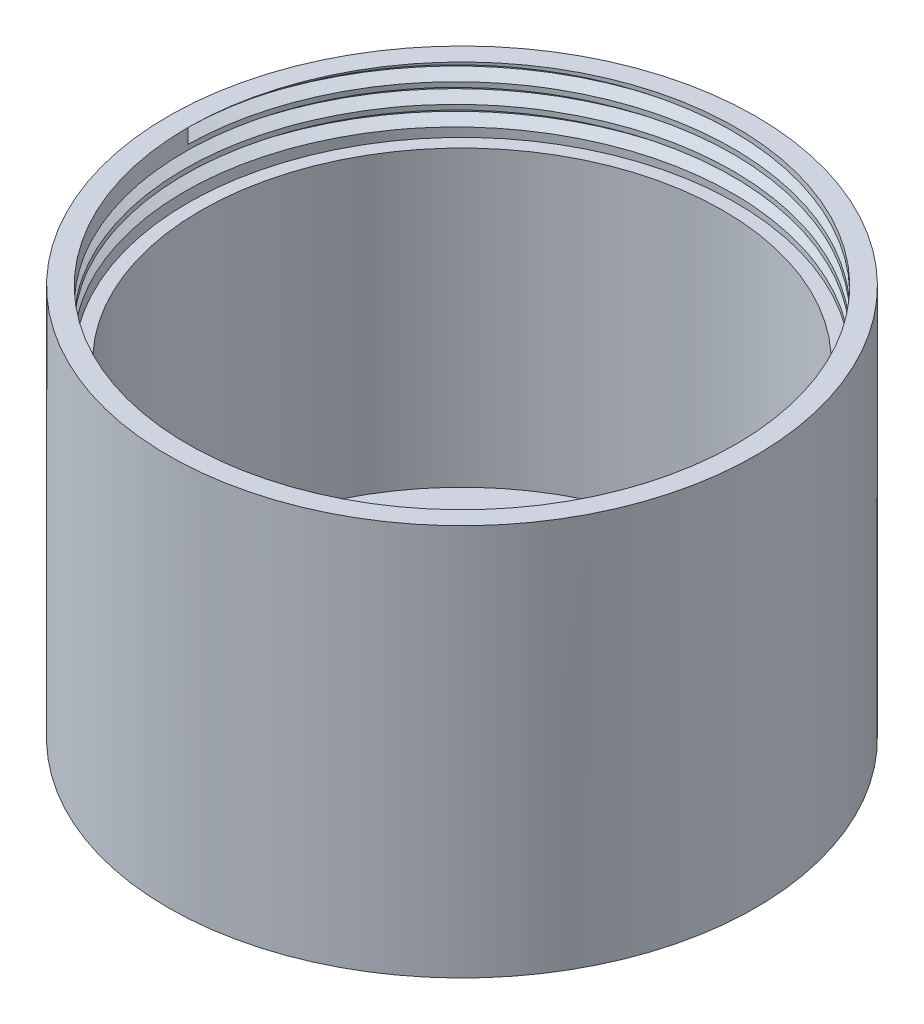
from build123d import *
from build123d.topology import SkipClean

# Parameters (mm, degrees)
SKETCH1_R           = 45
BOSS_EXTRUDE1_DEPTH = 50
SHELL1_T            = -5
SKETCH7_W           = 3
SKETCH7_H           = 10
THREAD2_PITCH       = 3


with BuildPart() as part:
    # Sketch1 → Boss-Extrude1 (new body)
    with BuildSketch(Plane(origin=(0, 0, 0), x_dir=(1, 0, 0), z_dir=(0, 1, 0))):
        with Locations(Location((0, 0, 0), (0, 0, 270))):
            Circle(SKETCH1_R)
    extrude(amount=BOSS_EXTRUDE1_DEPTH)

    # Shell1
    shell1_openings = [part.faces().sort_by_distance(p)[0] for p in [
        (0, 50, 0),
    ]]
    offset(amount=SHELL1_T, openings=shell1_openings, kind=Kind.INTERSECTION)

    # Sketch7 → Revolve2 (revolve)
    with SkipClean():  # the faces are left unmerged after this step: merging them gives an invalid solid
        with BuildSketch(Plane(origin=(0, 0, 0), x_dir=(0, 0, -1), z_dir=(1, 0, 0)), mode=Mode.PRIVATE) as revolve2_sk:
            with Locations((-43.5, 55)):
                Rectangle(SKETCH7_W, SKETCH7_H)
        revolve(revolve2_sk.sketch.rotate(Axis((0, 0, 0), (0, 1, 0)), 180), axis=Axis((0, 0, 0), (0, 1, 0)))

    # Thread2: the profile of Thread Profile2 profile screwed along a right-hand helix of 2.666667 turns, 10 arcs to a turn; built about Z, then put on its axis
    with SkipClean():  # the faces are left unmerged after this step: merging them gives an invalid solid
        thread2_z = Axis((0, 0, 0), (0, 0, 1))
        thread2_corners = [(41.9997, 0, -0.000173205), (43.623797625, 0, 0.937499996), (43.623797625, 0, 1.312499996), (41.9997, 0, 2.250173197)]
        with BuildLine(mode=Mode.PRIVATE) as thread2_profile:
            Line(thread2_corners[0], thread2_corners[1])
            Line(thread2_corners[1], thread2_corners[2])
            Line(thread2_corners[2], thread2_corners[3])
            Line(thread2_corners[3], thread2_corners[0])
        thread2_cap = Face(thread2_profile.wire())
        thread2_turn_angles = [0, 18, 36, 54, 72, 90, 108, 126, 144, 162, 180, 198, 216, 234, 252, 270, 288, 306, 324, 342, 360]
        thread2_turn_weights = [1, 0.9510565162951535, 1, 0.9510565162951535, 1, 0.9510565162951535, 1, 0.9510565162951535, 1, 0.9510565162951535, 1, 0.9510565162951535, 1, 0.9510565162951535, 1, 0.9510565162951535, 1, 0.9510565162951535, 1, 0.9510565162951535, 1]
        thread2_turn_rails = [Edge.make_bspline([Vector(p[0], p[1], 0).rotate(thread2_z, thread2_turn_angles[k]) / thread2_turn_weights[k] + Vector(0, 0, p[2] + THREAD2_PITCH * thread2_turn_angles[k] / 360) for k in range(21)], [0, 0, 0, 1, 1, 2, 2, 3, 3, 4, 4, 5, 5, 6, 6, 7, 7, 8, 8, 9, 9, 10, 10, 10], 2, thread2_turn_weights) for p in thread2_corners]
        thread2_turn_sides = [Face.make_surface_from_curves(thread2_turn_rails[p[0]], thread2_turn_rails[p[1]]) for p in [(0, 1), (1, 2), (2, 3), (3, 0)]]
        thread2_last_angles = [720, 738, 756, 774, 792, 810, 828, 846, 864, 882, 900, 918, 936, 948, 960]
        thread2_last_weights = [1, 0.9510565162951535, 1, 0.9510565162951535, 1, 0.9510565162951535, 1, 0.9510565162951535, 1, 0.9510565162951535, 1, 0.9510565162951535, 1, 0.978147600733806, 1]
        thread2_last_rails = [Edge.make_bspline([Vector(p[0], p[1], 0).rotate(thread2_z, thread2_last_angles[k]) / thread2_last_weights[k] + Vector(0, 0, p[2] + THREAD2_PITCH * thread2_last_angles[k] / 360) for k in range(15)], [0, 0, 0, 1, 1, 2, 2, 3, 3, 4, 4, 5, 5, 6, 6, 7, 7, 7], 2, thread2_last_weights) for p in thread2_corners]
        thread2_last_sides = [Face.make_surface_from_curves(thread2_last_rails[p[0]], thread2_last_rails[p[1]]) for p in [(0, 1), (1, 2), (2, 3), (3, 0)]]
        thread2 = Plane(origin=(0, 60, 0), x_dir=(-1, 0, 0), z_dir=(0, -1, 0)) * Solid(Shell([*[p.moved(Location((0, 0, THREAD2_PITCH * i))) for i in range(2) for p in thread2_turn_sides], *thread2_last_sides, thread2_cap, thread2_cap.rotate(thread2_z, 960).moved(Location((0, 0, THREAD2_PITCH * 960 / 360)))]))
        add(thread2, mode=Mode.SUBTRACT)


solid = part.part
